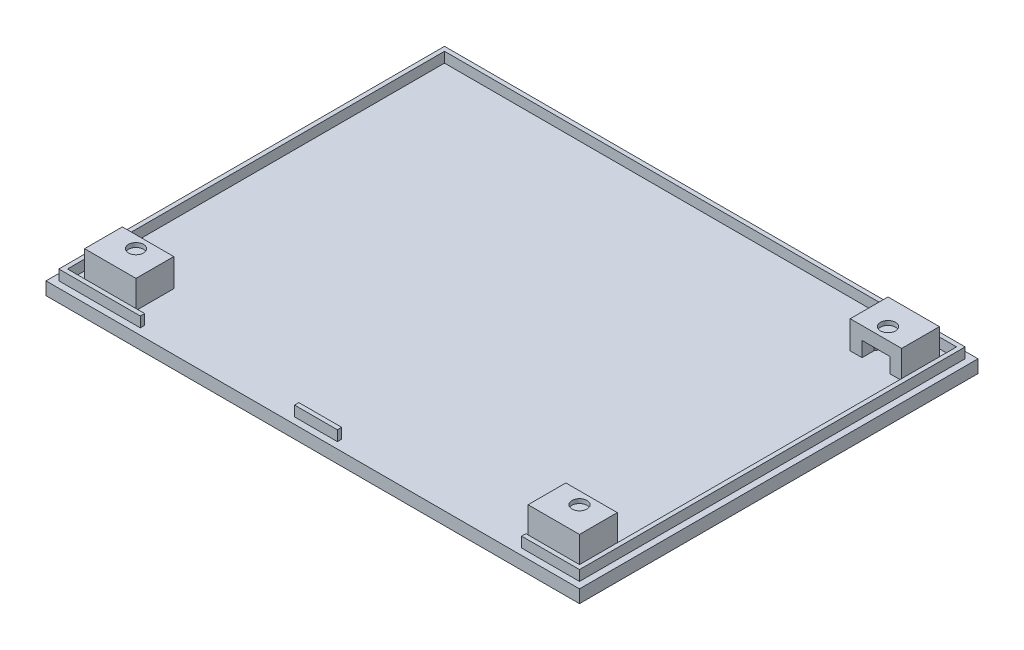
from build123d import *

# Parameters (mm, degrees)
SKETCH_1_W          = 124.5
SKETCH_1_H          = 93
EXTRUDE_1_DEPTH     = 3
SKETCH_2_W          = 10
SKETCH_2_H          = 1
EXTRUDE_1_2_DEPTH   = 2.4
EXTRUDE_2_DEPTH     = 3.5
SKETCH_4_W          = 12
SKETCH_4_H          = 8.814582562
EXTRUDE_3_DEPTH     = 3
SKETCH_5_R          = 1.75
CUT_EXTRUDE_1_DEPTH = 1


with BuildPart() as part:
    # Эскиз1 → Extrude 1 (new body)
    with BuildSketch(Plane(origin=(0, 0, 0), x_dir=(1, 0, 0), z_dir=(0, 1, 0))):
        Rectangle(SKETCH_1_W, SKETCH_1_H)
    extrude(amount=EXTRUDE_1_DEPTH)

    # Эскиз2 → Extrude 1 2 (add)
    with BuildSketch(Plane(origin=(0, 3, 0), x_dir=(1, 0, 0), z_dir=(0, 1, 0))):
        Polygon((-41.75, -44), (-59.75, -44), (-59.75, 44), (59.75, 44), (59.75, -44), (47.25, -44), (47.25, -45), (60.75, -45), (60.75, 45), (-60.75, 45), (-60.75, -45), (-41.75, -45), align=None)
        with Locations((-0.75, -44.5)):
            Rectangle(SKETCH_2_W, SKETCH_2_H)
    extrude(amount=EXTRUDE_1_2_DEPTH)

    # Эскиз3 → Бобышка-Вытянуть2 (add)
    with BuildSketch(Plane(origin=(0, 3, 0), x_dir=(1, 0, 0), z_dir=(0, 1, 0))):
        Polygon((-55, -36), (-55, -33.185417438), (-57.75, -33.185417438), (-57.75, -42), (-45.75, -42), (-45.75, -33.185417438), (-48.5, -33.185417438), (-48.5, -36), (-50.125, -38.814582562), (-53.375, -38.814582562), align=None)
        Polygon((55, 36), (55, 33.185417438), (57.75, 33.185417438), (57.75, 42), (45.75, 42), (45.75, 33.185417438), (48.5, 33.185417438), (48.5, 36), (50.125, 38.814582562), (53.375, 38.814582562), align=None)
        Polygon((55, -36), (55, -33.185417438), (57.75, -33.185417438), (57.75, -42), (45.75, -42), (45.75, -33.185417438), (48.5, -33.185417438), (48.5, -36), (50.125, -38.814582562), (53.375, -38.814582562), align=None)
    extrude(amount=EXTRUDE_2_DEPTH)

    # Эскиз4 → Бобышка-Вытянуть3 (add)
    with BuildSketch(Plane(origin=(0, 6.5, 0), x_dir=(1, 0, 0), z_dir=(0, 1, 0))):
        with Locations((-51.75, -37.592708719)):
            Rectangle(SKETCH_4_W, SKETCH_4_H)
        with Locations((51.75, -37.592708719)):
            Rectangle(SKETCH_4_W, SKETCH_4_H)
        with Locations((51.75, 37.592708719)):
            Rectangle(SKETCH_4_W, SKETCH_4_H)
    extrude(amount=EXTRUDE_3_DEPTH)

    # Эскиз5 → Вырез-Вытянуть1 (cut)
    with BuildSketch(Plane(origin=(0, 9.5, 0), x_dir=(1, 0, 0), z_dir=(0, 1, 0))):
        with Locations((-51.75, -36)):
            Circle(SKETCH_5_R)
        with Locations((51.75, -36)):
            Circle(SKETCH_5_R)
        with Locations((51.75, 36)):
            Circle(SKETCH_5_R)
    extrude(amount=-CUT_EXTRUDE_1_DEPTH, mode=Mode.SUBTRACT)


solid = part.part
